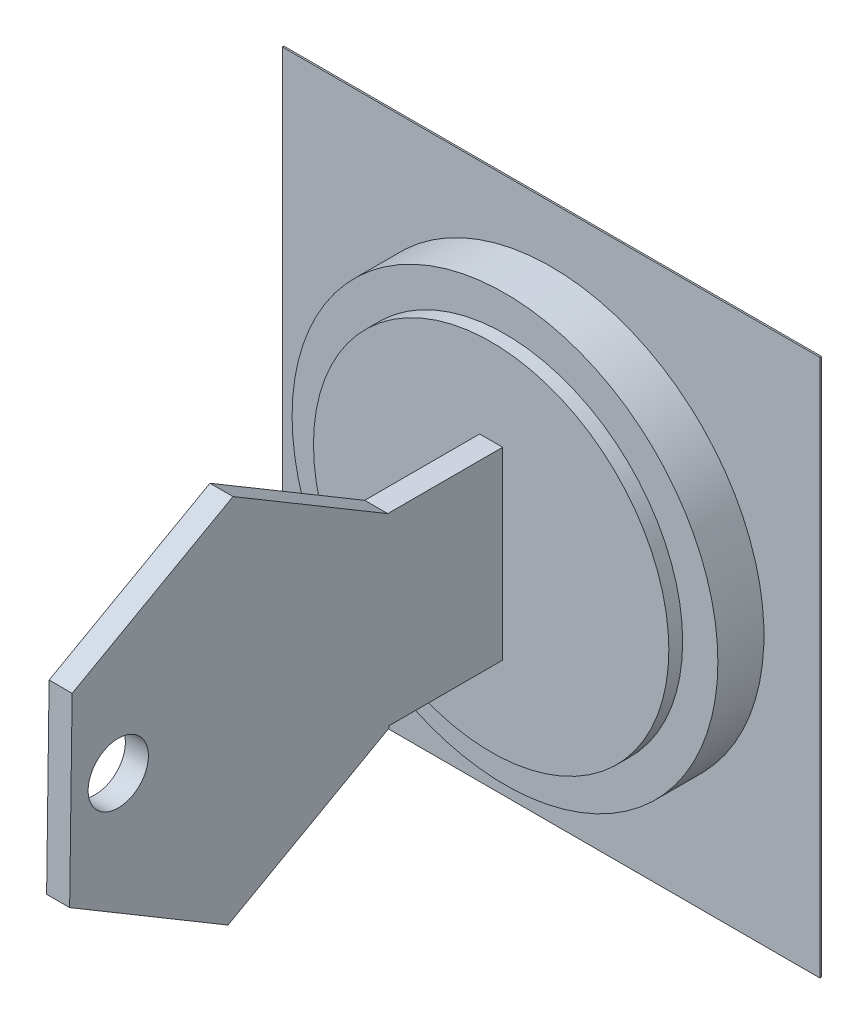
from build123d import *

# Parameters (mm, degrees)
CROQUIS1_W                  = 35
CROQUIS1_H                  = 35
SALIENTE_EXTRUIR1_DEPTH     = 0.1
CROQUIS2_R                  = 13.861230549
SALIENTE_EXTRUIR2_DEPTH     = 3
SALIENTE_EXTRUIR4_START     = 3.1
SALIENTE_EXTRUIR4_OUTLINE_R = 11.568568339
SALIENTE_EXTRUIR4_DEPTH     = 0.9
CROQUIS6_W                  = 1.5
CROQUIS6_H                  = 12
SALIENTE_EXTRUIR6_DEPTH     = 10
SALIENTE_EXTRUIR7_DEPTH     = 1.5
CROQUIS8_R                  = 1.963645542
CORTAR_EXTRUIR1_DEPTH       = 41.93570388


# Read off the part's stored shape, not the designer's step: Saliente-Extruir4
with BuildPart() as part:
    # Croquis1 → Saliente-Extruir1 (new body)
    with BuildSketch(Plane.XY):
        Rectangle(CROQUIS1_W, CROQUIS1_H)
    extrude(amount=SALIENTE_EXTRUIR1_DEPTH)

    # Croquis2 → Saliente-Extruir2 (add)
    with BuildSketch(Plane.XY.offset(0.1)):
        with Locations(Location((0, 0, 0), (0, 0, 180))):
            Circle(CROQUIS2_R)
    extrude(amount=SALIENTE_EXTRUIR2_DEPTH)

    # Saliente-Extruir4 outline → Saliente-Extruir4 (add)
    with BuildSketch(Plane.XY.offset(SALIENTE_EXTRUIR4_START)):
        Circle(SALIENTE_EXTRUIR4_OUTLINE_R)
    extrude(amount=SALIENTE_EXTRUIR4_DEPTH)

    # Croquis6 → Saliente-Extruir6 (add)
    with BuildSketch(Plane.XY.offset(4)):
        Rectangle(CROQUIS6_W, CROQUIS6_H)
    extrude(amount=SALIENTE_EXTRUIR6_DEPTH)

    # Croquis7 → Saliente-Extruir7 (add)
    with BuildSketch(Plane.ZY.offset(0.75)):
        Polygon((11.246605352, 5.859485217), (11.408857848, -6.140514783), (21.882288941, -12), (32.193467539, -5.859485217), (32.031215043, 6.140514783), (21.557783949, 12), align=None)
    extrude(amount=-SALIENTE_EXTRUIR7_DEPTH)

    # Croquis8 → Cortar-Extruir1 (cut, through all)
    with BuildSketch(Plane.ZY.offset(0.75)):
        with Locations((29.029224945, 0.140514783)):
            Circle(CROQUIS8_R)
    extrude(amount=-CORTAR_EXTRUIR1_DEPTH, mode=Mode.SUBTRACT)


solid = part.part
